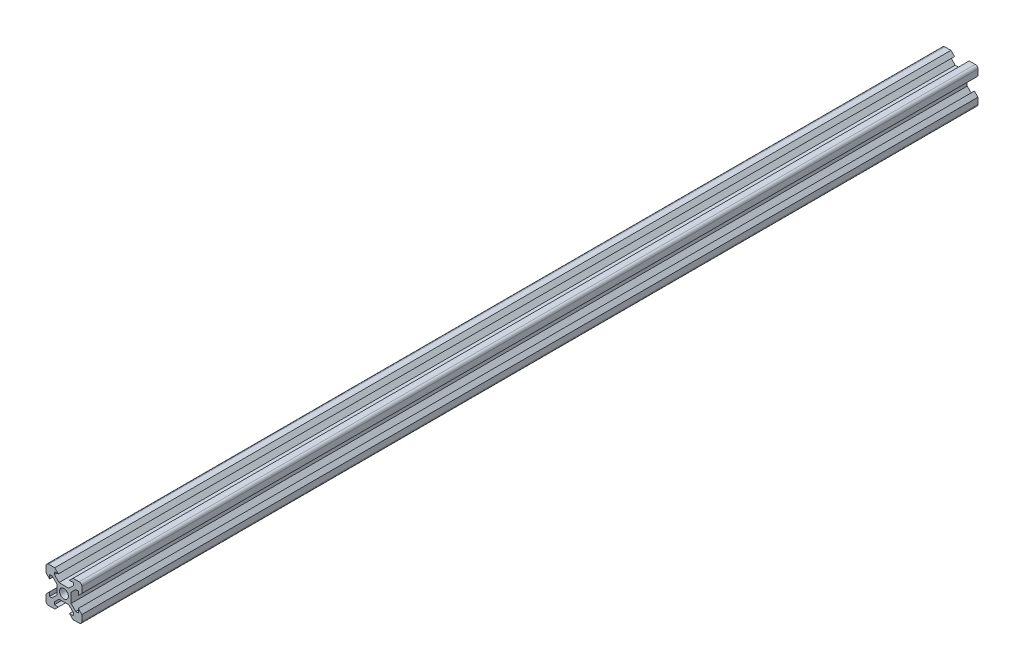
from build123d import *

# Parameters (mm, degrees)
EXTRUDE_1_OUTLINE_R = 2.5
EXTRUDE_1_DEPTH     = 500
FILLET_1_R          = 1.5


# Read off the part's stored shape, not the designer's step: Бобышка-Вытянуть1
with BuildPart() as part:
    # Бобышка-Вытянуть1 outline → Бобышка-Вытянуть1 (new body)
    with BuildSketch(Plane.XY):
        Polygon((4, 2.727207794), (6.572792206, 5.3), (8, 5.3), (8, 3.1), (10, 5.1), (10, 10), (5.1, 10), (3.1, 8), (5.3, 8), (5.3, 6.572792206), (2.727207794, 4), (-2.727207794, 4), (-5.3, 6.572792206), (-5.3, 8), (-3.1, 8), (-5.1, 10), (-10, 10), (-10, 5.1), (-8, 3.1), (-8, 5.3), (-6.572792206, 5.3), (-4, 2.727207794), (-4, -2.727207794), (-6.572792206, -5.3), (-8, -5.3), (-8, -3.1), (-10, -5.1), (-10, -10), (-5.1, -10), (-3.1, -8), (-5.3, -8), (-5.3, -6.572792206), (-2.727207794, -4), (2.727207794, -4), (5.3, -6.572792206), (5.3, -8), (3.1, -8), (5.1, -10), (10, -10), (10, -5.1), (8, -3.1), (8, -5.3), (6.572792206, -5.3), (4, -2.727207794), align=None)
        Circle(EXTRUDE_1_OUTLINE_R, mode=Mode.SUBTRACT)
    extrude(amount=EXTRUDE_1_DEPTH)

    # Скругление1
    fillet_1_edges = [part.edges().sort_by_distance(p)[0] for p in [
        (10, -10, 250),
        (-10, -10, 250),
        (-10, 10, 250),
        (10, 10, 250),
    ]]
    fillet(fillet_1_edges, radius=FILLET_1_R)


solid = part.part
